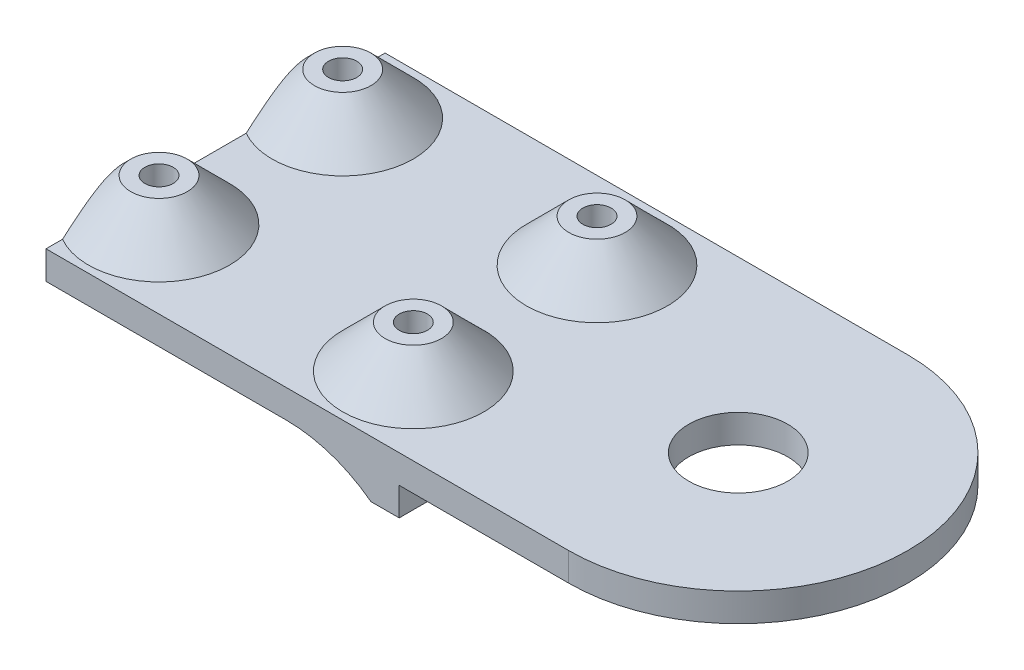
from build123d import *

# Parameters (mm, degrees)
ESBO_O1_W                = 11.5
ESBO_O1_H                = 24
ESBO_O1_R                = 2
ESBO_O1_R_2              = 3.5
ESBO_O1_W_2              = 2
RESSALTO_EXTRUS_O1_DEPTH = 2
ESBO_O1_3_R              = 2
ESBO_O1_3_R_2            = 1
RESSALTO_EXTRUS_O2_DEPTH = 5
ESBO_O1_4_W              = 2
ESBO_O1_4_H              = 24
RESSALTO_EXTRUS_O3_DEPTH = 2
CHANFRO1_SIZE            = 3
FILETE1_R                = 10


with BuildPart() as part:
    # Esboço1 → Ressalto-extrusão1 (new body)
    # profile 1 of 4: a face of its own
    with BuildSketch(Plane(origin=(0, 0, 0), x_dir=(1, 0, 0), z_dir=(0, 1, 0))):
        with Locations((5.75, 12)):
            Rectangle(ESBO_O1_W, ESBO_O1_H)
        with Locations(Location((2.5, 5.5, 0), (0, 0, 270))):
            Circle(ESBO_O1_R, mode=Mode.SUBTRACT)
        with Locations(Location((2.5, 18.5, 0), (0, 0, 270))):
            Circle(ESBO_O1_R, mode=Mode.SUBTRACT)
    # profile 2 of 4: a face of its own
    with BuildSketch(Plane(origin=(0, 0, 0), x_dir=(1, 0, 0), z_dir=(0, 1, 0))):
        with Locations((17.25, 12)):
            Rectangle(ESBO_O1_W, ESBO_O1_H)
        with Locations(Location((20.5, 5.5, 0), (0, 0, 270))):
            Circle(ESBO_O1_R, mode=Mode.SUBTRACT)
        with Locations(Location((20.5, 18.5, 0), (0, 0, 270))):
            Circle(ESBO_O1_R, mode=Mode.SUBTRACT)
    # profile 3 of 4: a face of its own
    with BuildSketch(Plane(origin=(0, 0, 0), x_dir=(1, 0, 0), z_dir=(0, 1, 0))):
        with BuildLine():
            Line((37, 24), (25, 24))
            Line((25, 24), (25, 0))
            Line((25, 0), (37, 0))
            ThreePointArc((37, 0), (49, 12), (37, 24))
        make_face()
        with Locations(Location((37, 12, 0), (0, 0, 270))):
            Circle(ESBO_O1_R_2, mode=Mode.SUBTRACT)
    # profile 4 of 4: a face of its own
    with BuildSketch(Plane(origin=(0, 0, 0), x_dir=(1, 0, 0), z_dir=(0, 1, 0))):
        with Locations((24, 12)):
            Rectangle(ESBO_O1_W_2, ESBO_O1_H)
    extrude(amount=RESSALTO_EXTRUS_O1_DEPTH)

    # Esboço1<3> → Ressalto-extrusão2 (add)
    # profile 1 of 4: a face of its own
    with BuildSketch(Plane(origin=(0, 0, 0), x_dir=(1, 0, 0), z_dir=(0, 1, 0))):
        with Locations(Location((20.5, 18.5, 0), (0, 0, 270))):
            Circle(ESBO_O1_3_R)
        with Locations(Location((20.5, 18.5, 0), (0, 0, 270))):
            Circle(ESBO_O1_3_R_2, mode=Mode.SUBTRACT)
    # profile 2 of 4: a face of its own
    with BuildSketch(Plane(origin=(0, 0, 0), x_dir=(1, 0, 0), z_dir=(0, 1, 0))):
        with Locations(Location((2.5, 18.5, 0), (0, 0, 270))):
            Circle(ESBO_O1_3_R)
        with Locations(Location((2.5, 18.5, 0), (0, 0, 270))):
            Circle(ESBO_O1_3_R_2, mode=Mode.SUBTRACT)
    # profile 3 of 4: a face of its own
    with BuildSketch(Plane(origin=(0, 0, 0), x_dir=(1, 0, 0), z_dir=(0, 1, 0))):
        with Locations(Location((2.5, 5.5, 0), (0, 0, 270))):
            Circle(ESBO_O1_3_R)
        with Locations(Location((2.5, 5.5, 0), (0, 0, 270))):
            Circle(ESBO_O1_3_R_2, mode=Mode.SUBTRACT)
    # profile 4 of 4: a face of its own
    with BuildSketch(Plane(origin=(0, 0, 0), x_dir=(1, 0, 0), z_dir=(0, 1, 0))):
        with Locations(Location((20.5, 5.5, 0), (0, 0, 270))):
            Circle(ESBO_O1_3_R)
        with Locations(Location((20.5, 5.5, 0), (0, 0, 270))):
            Circle(ESBO_O1_3_R_2, mode=Mode.SUBTRACT)
    extrude(amount=RESSALTO_EXTRUS_O2_DEPTH)

    # Esboço1<4> → Ressalto-extrusão3 (add)
    with BuildSketch(Plane(origin=(0, 0, 0), x_dir=(1, 0, 0), z_dir=(0, 1, 0))):
        with Locations((24, 12)):
            Rectangle(ESBO_O1_4_W, ESBO_O1_4_H)
    extrude(amount=-RESSALTO_EXTRUS_O3_DEPTH)

    # Chanfro1
    # the kernel refuses this chamfer: 3 mm, written as the material it adds along each edge
    with BuildSketch(Plane(origin=(20.5, 2, -18.5), x_dir=(0, 0, 1), z_dir=(-1, 0, 0))) as chanfro1_piece_1_section:
        Polygon((2 + CHANFRO1_SIZE, 0), (2, CHANFRO1_SIZE), (2, 0), align=None)
    chanfro1_piece_1 = revolve(axis=Axis((20.5, 2, -18.5), (0, 1, 0)), mode=Mode.PRIVATE)
    chanfro1_piece_1 = split(chanfro1_piece_1, bisect_by=Plane(origin=(20.5, 5, -22.010399956), z_dir=(0, -1, 0)), keep=Keep.TOP, mode=Mode.PRIVATE)
    add(chanfro1_piece_1)
    with BuildSketch(Plane(origin=(2.5, 2, -18.5), x_dir=(0, 0, 1), z_dir=(-1, 0, 0))) as chanfro1_piece_2_section:
        Polygon((2 + CHANFRO1_SIZE, 0), (2, CHANFRO1_SIZE), (2, 0), align=None)
    chanfro1_piece_2 = revolve(axis=Axis((2.5, 2, -18.5), (0, 1, 0)), mode=Mode.PRIVATE)
    chanfro1_piece_2 = split(chanfro1_piece_2, bisect_by=Plane(origin=(0, 3.427479449, -22.012332263), z_dir=(1, 0, 0)), keep=Keep.TOP, mode=Mode.PRIVATE)
    chanfro1_piece_2 = split(chanfro1_piece_2, bisect_by=Plane(origin=(2.5, 5, -22.012332263), z_dir=(0, -1, 0)), keep=Keep.TOP, mode=Mode.PRIVATE)
    add(chanfro1_piece_2)
    with BuildSketch(Plane(origin=(2.5, 2, -5.5), x_dir=(0, 0, 1), z_dir=(-1, 0, 0))) as chanfro1_piece_3_section:
        Polygon((2 + CHANFRO1_SIZE, 0), (2, CHANFRO1_SIZE), (2, 0), align=None)
    chanfro1_piece_3 = revolve(axis=Axis((2.5, 2, -5.5), (0, 1, 0)), mode=Mode.PRIVATE)
    chanfro1_piece_3 = split(chanfro1_piece_3, bisect_by=Plane(origin=(0, 3.427479449, -9.012332263), z_dir=(1, 0, 0)), keep=Keep.TOP, mode=Mode.PRIVATE)
    chanfro1_piece_3 = split(chanfro1_piece_3, bisect_by=Plane(origin=(2.5, 5, -9.012332263), z_dir=(0, -1, 0)), keep=Keep.TOP, mode=Mode.PRIVATE)
    add(chanfro1_piece_3)
    with BuildSketch(Plane(origin=(20.5, 2, -5.5), x_dir=(0, 0, 1), z_dir=(-1, 0, 0))) as chanfro1_piece_4_section:
        Polygon((2 + CHANFRO1_SIZE, 0), (2, CHANFRO1_SIZE), (2, 0), align=None)
    chanfro1_piece_4 = revolve(axis=Axis((20.5, 2, -5.5), (0, 1, 0)), mode=Mode.PRIVATE)
    chanfro1_piece_4 = split(chanfro1_piece_4, bisect_by=Plane(origin=(20.5, 5, -9.010399956), z_dir=(0, -1, 0)), keep=Keep.TOP, mode=Mode.PRIVATE)
    add(chanfro1_piece_4)

    # Filete1
    # the kernel refuses this fillet: 10 mm, written as the material it adds along each edge
    with BuildSketch(Plane(origin=(23, 0, -24), x_dir=(-1, 0, 0), z_dir=(0, 0, 1))) as filete1_piece_1_section:
        with BuildLine():
            CenterArc((6, 10), FILETE1_R, 233.130102354, 36.869897646)
            Line((0, 2), (-0.12, 1.84))
            ThreePointArc((-0.12, 1.84), (-0.2, 1), (-0.2, 0))
            Line((-0.2, 0), (0, -0.2))
            Line((0, -0.2), (6, -0.2))
            Line((6, -0.2), (6, 0))
        make_face()
    filete1_piece_1 = extrude(amount=24, mode=Mode.PRIVATE)
    filete1_piece_1 = filete1_piece_1 - Plane(origin=(20.5, -0.461272254, -5.5), x_dir=(0, 0, 1), z_dir=(0, -1, 0)) * Cylinder(1, 73, mode=Mode.PRIVATE)
    filete1_piece_1 = filete1_piece_1 - Plane(origin=(20.5, -0.461272254, -18.5), x_dir=(0, 0, 1), z_dir=(0, -1, 0)) * Cylinder(1, 73, mode=Mode.PRIVATE)
    add(filete1_piece_1)


solid = part.part
